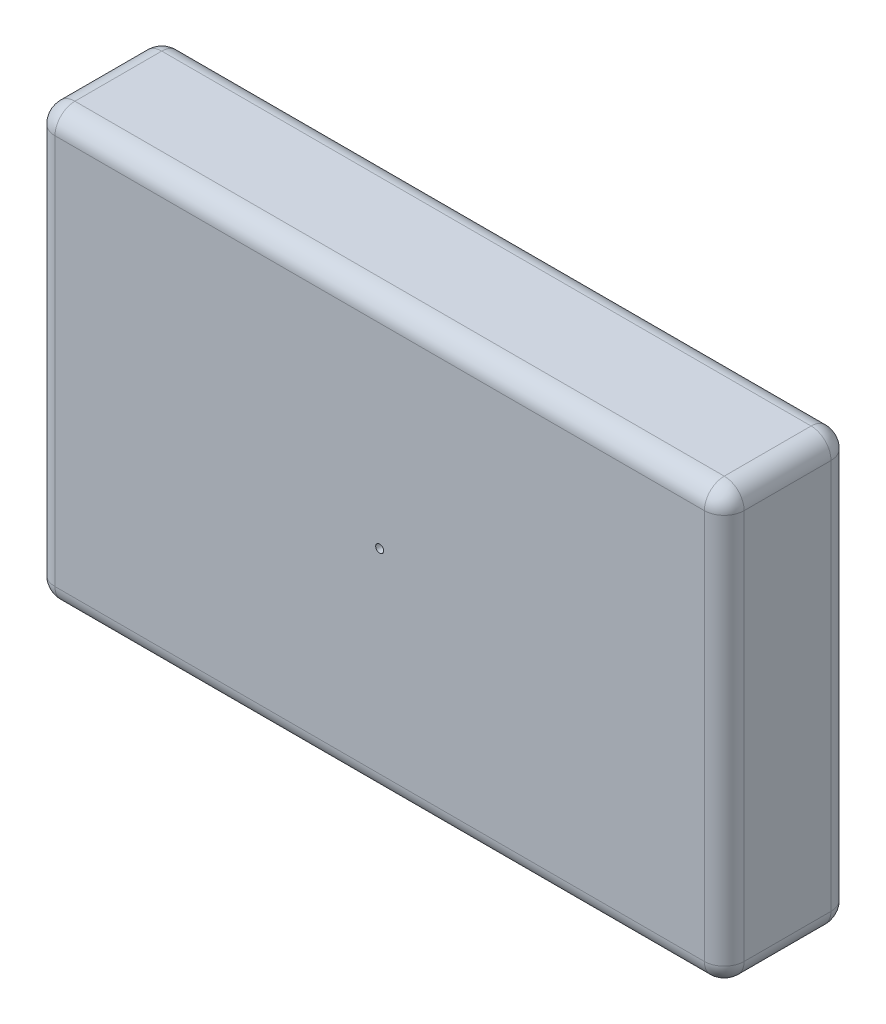
from build123d import *

# Parameters (mm, degrees)
CROQUIS1_W              = 173
CROQUIS1_H              = 108
SALIENTE_EXTRUIR1_DEPTH = 31.8
REDONDEO1_R             = 5
REDONDEO2_R             = 5
REDONDEO3_R             = 5
CROQUIS2_R              = 1
CORTAR_EXTRUIR1_DEPTH   = 10


with BuildPart() as part:
    # Croquis1 → Saliente-Extruir1 (new body)
    with BuildSketch(Plane.XY):
        Rectangle(CROQUIS1_W, CROQUIS1_H)
    extrude(amount=SALIENTE_EXTRUIR1_DEPTH)

    # Redondeo1
    redondeo1_edges = [part.edges().sort_by_distance(p)[0] for p in [
        (-86.5, 0, 31.8),
        (0, -54, 31.8),
        (86.5, 0, 31.8),
        (0, 54, 31.8),
    ]]
    fillet(redondeo1_edges, radius=REDONDEO1_R)

    # Redondeo2
    redondeo2_edges = [part.edges().sort_by_distance(p)[0] for p in [
        (0, -54, 0),
        (-86.5, 0, 0),
        (0, 54, 0),
        (86.5, 0, 0),
    ]]
    fillet(redondeo2_edges, radius=REDONDEO2_R)

    # Redondeo3
    # the kernel refuses this fillet: 5 mm, written as the material it takes off along each edge
    with BuildSketch(Plane(origin=(-81.5, 49, 26.8), x_dir=(-1, 0, 0), z_dir=(0, 1, 0))) as redondeo3_piece_1_section:
        Polygon((0, 0), (REDONDEO3_R, 0), (REDONDEO3_R, REDONDEO3_R), (0, REDONDEO3_R), align=None)
    redondeo3_piece_1 = extrude(amount=REDONDEO3_R, mode=Mode.PRIVATE)
    redondeo3_piece_1 = redondeo3_piece_1 - Plane(origin=(-81.5, 49, 26.8), x_dir=(0.7071067811865475, 0, -0.7071067811865475), z_dir=(0, 1, 0)) * Sphere(REDONDEO3_R, mode=Mode.PRIVATE)
    add(redondeo3_piece_1, mode=Mode.SUBTRACT)
    with BuildSketch(Plane(origin=(81.5, 49, 26.8), x_dir=(1, 0, 0), z_dir=(0, 1, 0))) as redondeo3_piece_2_section:
        Polygon((0, 0), (REDONDEO3_R, 0), (REDONDEO3_R, -REDONDEO3_R), (0, -REDONDEO3_R), align=None)
    redondeo3_piece_2 = extrude(amount=REDONDEO3_R, mode=Mode.PRIVATE)
    redondeo3_piece_2 = redondeo3_piece_2 - Plane(origin=(81.5, 49, 26.8), x_dir=(-0.7071067811865475, 0, -0.7071067811865475), z_dir=(0, 1, 0)) * Sphere(REDONDEO3_R, mode=Mode.PRIVATE)
    add(redondeo3_piece_2, mode=Mode.SUBTRACT)
    with BuildSketch(Plane(origin=(-81.5, -49, 26.8), x_dir=(0, -1, 0), z_dir=(-1, 0, 0))) as redondeo3_piece_3_section:
        Polygon((0, 0), (REDONDEO3_R, 0), (REDONDEO3_R, REDONDEO3_R), (0, REDONDEO3_R), align=None)
    redondeo3_piece_3 = extrude(amount=REDONDEO3_R, mode=Mode.PRIVATE)
    redondeo3_piece_3 = redondeo3_piece_3 - Plane(origin=(-81.5, -49, 26.8), x_dir=(0, 0.7071067811865475, -0.7071067811865475), z_dir=(-1, 0, 0)) * Sphere(REDONDEO3_R, mode=Mode.PRIVATE)
    add(redondeo3_piece_3, mode=Mode.SUBTRACT)
    with BuildSketch(Plane(origin=(81.5, -49, 26.8), x_dir=(0, -1, 0), z_dir=(1, 0, 0))) as redondeo3_piece_4_section:
        Polygon((0, 0), (REDONDEO3_R, 0), (REDONDEO3_R, -REDONDEO3_R), (0, -REDONDEO3_R), align=None)
    redondeo3_piece_4 = extrude(amount=REDONDEO3_R, mode=Mode.PRIVATE)
    redondeo3_piece_4 = redondeo3_piece_4 - Plane(origin=(81.5, -49, 26.8), x_dir=(0, 0.7071067811865475, -0.7071067811865475), z_dir=(1, 0, 0)) * Sphere(REDONDEO3_R, mode=Mode.PRIVATE)
    add(redondeo3_piece_4, mode=Mode.SUBTRACT)
    with BuildSketch(Plane(origin=(81.5, -49, 5), x_dir=(0, -1, 0), z_dir=(1, 0, 0))) as redondeo3_piece_5_section:
        Polygon((0, 0), (REDONDEO3_R, 0), (REDONDEO3_R, REDONDEO3_R), (0, REDONDEO3_R), align=None)
    redondeo3_piece_5 = extrude(amount=REDONDEO3_R, mode=Mode.PRIVATE)
    redondeo3_piece_5 = redondeo3_piece_5 - Plane(origin=(81.5, -49, 5), x_dir=(0, 0.7071067811865475, 0.7071067811865475), z_dir=(1, 0, 0)) * Sphere(REDONDEO3_R, mode=Mode.PRIVATE)
    add(redondeo3_piece_5, mode=Mode.SUBTRACT)
    with BuildSketch(Plane(origin=(-81.5, -49, 5), x_dir=(0, -1, 0), z_dir=(-1, 0, 0))) as redondeo3_piece_6_section:
        Polygon((0, 0), (REDONDEO3_R, 0), (REDONDEO3_R, -REDONDEO3_R), (0, -REDONDEO3_R), align=None)
    redondeo3_piece_6 = extrude(amount=REDONDEO3_R, mode=Mode.PRIVATE)
    redondeo3_piece_6 = redondeo3_piece_6 - Plane(origin=(-81.5, -49, 5), x_dir=(0, 0.7071067811865475, 0.7071067811865475), z_dir=(-1, 0, 0)) * Sphere(REDONDEO3_R, mode=Mode.PRIVATE)
    add(redondeo3_piece_6, mode=Mode.SUBTRACT)
    with BuildSketch(Plane(origin=(81.5, 49, 5), x_dir=(1, 0, 0), z_dir=(0, 1, 0))) as redondeo3_piece_7_section:
        Polygon((0, 0), (REDONDEO3_R, 0), (REDONDEO3_R, REDONDEO3_R), (0, REDONDEO3_R), align=None)
    redondeo3_piece_7 = extrude(amount=REDONDEO3_R, mode=Mode.PRIVATE)
    redondeo3_piece_7 = redondeo3_piece_7 - Plane(origin=(81.5, 49, 5), x_dir=(-0.7071067811865475, 0, 0.7071067811865475), z_dir=(0, 1, 0)) * Sphere(REDONDEO3_R, mode=Mode.PRIVATE)
    add(redondeo3_piece_7, mode=Mode.SUBTRACT)
    with BuildSketch(Plane(origin=(-81.5, 49, 5), x_dir=(-1, 0, 0), z_dir=(0, 1, 0))) as redondeo3_piece_8_section:
        Polygon((0, 0), (REDONDEO3_R, 0), (REDONDEO3_R, -REDONDEO3_R), (0, -REDONDEO3_R), align=None)
    redondeo3_piece_8 = extrude(amount=REDONDEO3_R, mode=Mode.PRIVATE)
    redondeo3_piece_8 = redondeo3_piece_8 - Plane(origin=(-81.5, 49, 5), x_dir=(0.7071067811865475, 0, 0.7071067811865475), z_dir=(0, 1, 0)) * Sphere(REDONDEO3_R, mode=Mode.PRIVATE)
    add(redondeo3_piece_8, mode=Mode.SUBTRACT)
    with BuildSketch(Plane(origin=(86.5, -54, 5), x_dir=(0, 1, 0), z_dir=(0, 0, 1)), Plane(origin=(86.5, 54, 5), x_dir=(-1, 0, 0), z_dir=(0, 0, 1))) as redondeo3_piece_9:
        with BuildLine():
            CenterArc((REDONDEO3_R, REDONDEO3_R), REDONDEO3_R, 180, 90)
            Line((0, REDONDEO3_R), (0, 0))
            Line((0, 0), (REDONDEO3_R, 0))
        make_face()
    extrude(amount=21.8, mode=Mode.SUBTRACT)
    with BuildSketch(Plane(origin=(-86.5, -54, 5), x_dir=(0, 1, 0), z_dir=(0, 0, 1)), Plane(origin=(-86.5, 54, 5), x_dir=(1, 0, 0), z_dir=(0, 0, 1))) as redondeo3_piece_10:
        with BuildLine():
            CenterArc((REDONDEO3_R, -REDONDEO3_R), REDONDEO3_R, 90, 90)
            Line((0, -REDONDEO3_R), (0, 0))
            Line((0, 0), (REDONDEO3_R, 0))
        make_face()
    extrude(amount=21.8, mode=Mode.SUBTRACT)

    # Croquis2 → Cortar-Extruir1 (cut)
    with BuildSketch(Plane.XY.offset(31.8)):
        Circle(CROQUIS2_R)
    extrude(amount=-CORTAR_EXTRUIR1_DEPTH, mode=Mode.SUBTRACT)


solid = part.part
